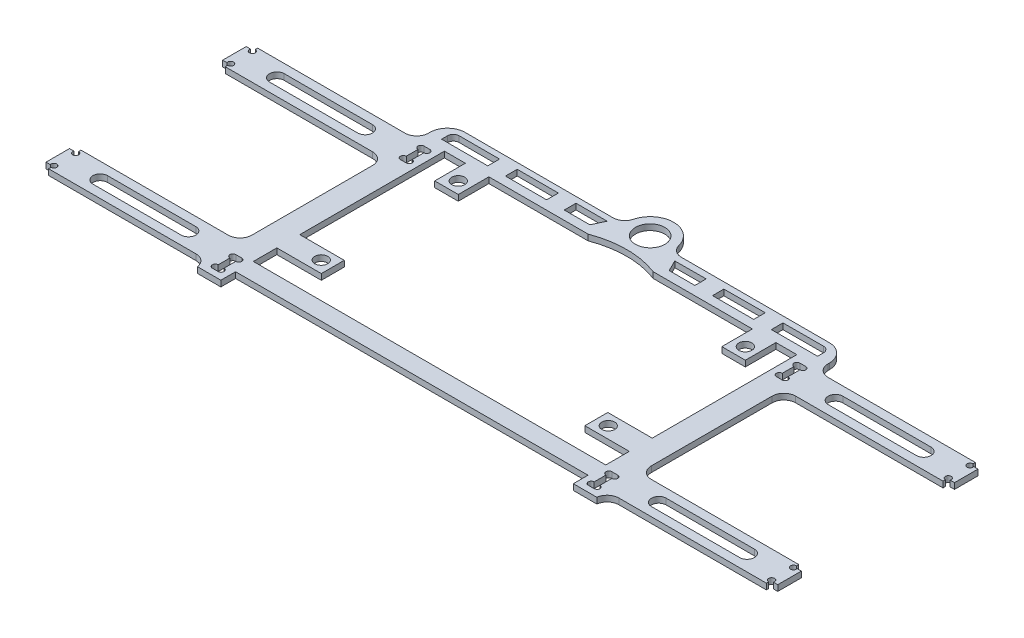
from build123d import *

# Parameters (mm, degrees)
SKETCH_1_R          = 2.5
SKETCH_1_R_2        = 1.1
EXTRUDE_1_DEPTH     = 1
FILLET_1_R          = 3
FILLET_2_R          = 2
CUT_EXTRUDE_2_DEPTH = 10
FILLET_3_R          = 2
FILLET_4_R          = 1


with BuildPart() as part:
    # 草图1 → 凸台-拉伸1 (new body)
    with BuildSketch(Plane(origin=(0, 0, 0), x_dir=(1, 0, 0), z_dir=(0, 1, 0))):
        with BuildLine():
            Line((52.019723734, 21.852163266), (53.019723735, 21.852163266))
            Line((53.019723735, 21.852163266), (53.019757158, 21.448163261))
            ThreePointArc((53.019757158, 21.448163261), (52.725753796, 20.543789849), (53.495525432, 21.102163266))
            Line((53.495525432, 21.102163266), (53.519723734, 21.102163266))
            Line((53.519723734, 21.102163266), (54.019723733, 21.102163266))
            Line((54.019723733, 21.102163266), (54.219723734, 21.102163266))
            Line((54.219723734, 21.102163266), (54.219723734, 17.102163266))
            Line((54.219723734, 17.102163266), (54.019723733, 17.102163266))
            Line((54.019723733, 17.102163266), (53.519723734, 17.102163266))
            Line((53.519723734, 17.102163266), (53.496801854, 17.102163266))
            ThreePointArc((53.496801854, 17.102163266), (52.724058887, 17.655298623), (53.01975629, 16.752163272))
            Line((53.01975629, 16.752163272), (53.019723735, 16.352163266))
            Line((53.019723735, 16.352163266), (52.019723734, 16.352163266))
            Line((52.019723734, 16.352163266), (25.97614752, 16.352163266))
            Line((25.97614752, 16.352163266), (25.97614752, -8.184190297))
            Line((25.97614752, -8.184190297), (51.519723734, -8.184190297))
            Line((51.519723734, -8.184190297), (52.019723734, -8.184190297))
            Line((52.019723734, -8.184190297), (53.019723735, -8.184190297))
            Line((53.019723735, -8.184190297), (53.019748777, -8.580190295))
            ThreePointArc((53.019748777, -8.580190295), (52.724061912, -9.483327864), (53.496801857, -8.930190297))
            Line((53.496801857, -8.930190297), (53.519723734, -8.930190297))
            Line((53.519723734, -8.930190297), (54.019723734, -8.930190297))
            Line((54.019723734, -8.930190297), (54.219723734, -8.930190297))
            Line((54.219723734, -8.930190297), (54.219723734, -12.930190297))
            Line((54.219723734, -12.930190297), (54.019723734, -12.930190297))
            Line((54.019723734, -12.930190297), (53.519723734, -12.930190297))
            Line((53.519723734, -12.930190297), (53.496801854, -12.930190297))
            ThreePointArc((53.496801854, -12.930190297), (52.724072011, -12.377045312), (53.019723734, -13.280190285))
            Line((53.019723734, -13.280190285), (53.019723734, -13.680190297))
            Line((53.019723734, -13.680190297), (52.019723734, -13.680190297))
            Line((52.019723734, -13.680190297), (25.97614752, -13.680190297))
            Line((25.97614752, -13.680190297), (25.97614752, -13.930190297))
            Line((25.97614752, -13.930190297), (25.97614752, -15.447203953))
            Line((25.97614752, -15.447203953), (21.97614752, -15.447203953))
            Line((21.97614752, -15.447203953), (21.97614752, -12.947203953))
            Line((21.97614752, -12.947203953), (-37.940585629, -12.947203953))
            Line((-37.940585629, -12.947203953), (-37.940585629, -15.447203953))
            Line((-37.940585629, -15.447203953), (-41.940585629, -15.447203953))
            Line((-41.940585629, -15.447203953), (-41.940585629, -13.930190297))
            Line((-41.940585629, -13.930190297), (-41.940585629, -13.680190297))
            Line((-41.940585629, -13.680190297), (-67.984161843, -13.680190297))
            Line((-67.984161843, -13.680190297), (-68.984161843, -13.680190297))
            Line((-68.984161843, -13.680190297), (-68.984161843, -13.280190297))
            ThreePointArc((-68.984161843, -13.280190297), (-68.688357854, -12.37707741), (-69.461131444, -12.930190297))
            Line((-69.461131444, -12.930190297), (-69.484161843, -12.930190297))
            Line((-69.484161843, -12.930190297), (-69.984161843, -12.930190297))
            Line((-69.984161843, -12.930190297), (-70.184161843, -12.930190297))
            Line((-70.184161843, -12.930190297), (-70.184161843, -8.930190297))
            Line((-70.184161843, -8.930190297), (-69.984161843, -8.930190297))
            Line((-69.984161843, -8.930190297), (-69.484161843, -8.930190297))
            Line((-69.484161843, -8.930190297), (-69.461131444, -8.930190297))
            ThreePointArc((-69.461131444, -8.930190297), (-68.688357854, -9.483303184), (-68.984161844, -8.580190297))
            Line((-68.984161844, -8.580190297), (-68.984161844, -8.184190297))
            Line((-68.984161844, -8.184190297), (-67.984161843, -8.184190297))
            Line((-67.984161843, -8.184190297), (-67.484161843, -8.184190297))
            Line((-67.484161843, -8.184190297), (-41.940585629, -8.184190297))
            Line((-41.940585629, -8.184190297), (-41.940585629, 16.352163266))
            Line((-41.940585629, 16.352163266), (-67.984161843, 16.352163266))
            Line((-67.984161843, 16.352163266), (-68.984161844, 16.352163266))
            Line((-68.984161844, 16.352163266), (-68.984161844, 16.756163266))
            ThreePointArc((-68.984161844, 16.756163266), (-68.689970599, 17.660454636), (-69.459917768, 17.102357219))
            Line((-69.459917768, 17.102357219), (-69.484161843, 17.102163266))
            Line((-69.484161843, 17.102163266), (-69.984161842, 17.102163266))
            Line((-69.984161842, 17.102163266), (-70.184161842, 17.102163266))
            Line((-70.184161842, 17.102163266), (-70.184161842, 21.102163266))
            Line((-70.184161842, 21.102163266), (-69.984161842, 21.102163266))
            Line((-69.984161842, 21.102163266), (-69.484161843, 21.102163266))
            Line((-69.484161843, 21.102163266), (-69.461131444, 21.102163266))
            ThreePointArc((-69.461131444, 21.102163266), (-68.688357854, 20.549050379), (-68.984161844, 21.452163266))
            Line((-68.984161844, 21.452163266), (-68.984161844, 21.852163266))
            Line((-68.984161844, 21.852163266), (-67.984161843, 21.852163266))
            Line((-67.984161843, 21.852163266), (-41.940585629, 21.852163266))
            Line((-41.940585629, 21.852163266), (-41.940585629, 22.106163266))
            Line((-41.940585629, 22.106163266), (-41.940585629, 23.122837731))
            Line((-41.940585629, 23.122837731), (-41.940585629, 27.072840592))
            Line((-41.940585629, 27.072840592), (-11.950846021, 27.072840592))
            ThreePointArc((-11.950846021, 27.072840592), (-7.982219055, 31.572840592), (-4.013592088, 27.072840592))
            Line((-4.013592088, 27.072840592), (25.97614752, 27.072840592))
            Line((25.97614752, 27.072840592), (25.97614752, 23.122837731))
            Line((25.97614752, 23.122837731), (25.97614752, 22.106163266))
            Line((25.97614752, 22.106163266), (25.97614752, 21.852163266))
            Line((25.97614752, 21.852163266), (52.019723734, 21.852163266))
        make_face()
        with Locations(Location((-7.982219055, 27.572840592, 0), (0, 0, 270))):
            Circle(SKETCH_1_R, mode=Mode.SUBTRACT)
        with Locations(Location((-32.382219055, 19.352796047, 0), (0, 0, 270))):
            Circle(SKETCH_1_R_2, mode=Mode.SUBTRACT)
        with Locations(Location((16.417780945, 19.352796047, 0), (0, 0, 270))):
            Circle(SKETCH_1_R_2, mode=Mode.SUBTRACT)
        with Locations(Location((-32.382219055, -3.947203953, 0), (0, 0, 270))):
            Circle(SKETCH_1_R_2, mode=Mode.SUBTRACT)
        with Locations(Location((16.417780945, -3.947203953, 0), (0, 0, 270))):
            Circle(SKETCH_1_R_2, mode=Mode.SUBTRACT)
        with BuildLine():
            Line((-37.940585629, 20.052796047), (-37.940585629, 17.052796047))
            Line((-37.940585629, 17.052796047), (-37.940585629, 16.552796047))
            Line((-37.940585629, 16.552796047), (-37.940585629, -2.030190297))
            Line((-37.940585629, -2.030190297), (-30.582219055, -2.030190297))
            Line((-30.582219055, -2.030190297), (-30.382219055, -2.030190297))
            Line((-30.382219055, -2.030190297), (-30.382219055, -5.930190297))
            Line((-30.382219055, -5.930190297), (-37.940585629, -5.930190297))
            Line((-37.940585629, -5.930190297), (-37.940585629, -6.730190297))
            Line((-37.940585629, -6.730190297), (-37.940585629, -8.930190297))
            Line((-37.940585629, -8.930190297), (-37.940585629, -9.930190297))
            Line((-37.940585629, -9.930190297), (21.97614752, -9.930190297))
            Line((21.97614752, -9.930190297), (21.97614752, -8.930190297))
            Line((21.97614752, -8.930190297), (21.97614752, -6.730190297))
            Line((21.97614752, -6.730190297), (21.97614752, -5.930190297))
            Line((21.97614752, -5.930190297), (14.417780946, -5.930190297))
            Line((14.417780946, -5.930190297), (14.417780946, -2.030190297))
            Line((14.417780946, -2.030190297), (21.97614752, -2.030190297))
            Line((21.97614752, -2.030190297), (21.97614752, 16.552796047))
            Line((21.97614752, 16.552796047), (21.97614752, 20.552796047))
            Line((21.97614752, 20.552796047), (21.97614752, 21.552796047))
            Line((21.97614752, 21.552796047), (21.97614752, 22.552796047))
            Line((21.97614752, 22.552796047), (18.417780946, 22.552796047))
            Line((18.417780946, 22.552796047), (18.417780946, 17.352796047))
            Line((18.417780946, 17.352796047), (14.417780946, 17.352796047))
            Line((14.417780946, 17.352796047), (14.417780946, 22.552796047))
            Line((14.417780946, 22.552796047), (-1.176889757, 22.552796047))
            Line((-1.176889757, 22.552796047), (-2.453882338, 22.552796047))
            ThreePointArc((-2.453882338, 22.552796047), (-7.982219055, 23.572205826), (-13.510555771, 22.552796047))
            Line((-13.510555771, 22.552796047), (-14.787548352, 22.552796047))
            Line((-14.787548352, 22.552796047), (-30.382219055, 22.552796047))
            Line((-30.382219055, 22.552796047), (-30.382219055, 17.352796047))
            Line((-30.382219055, 17.352796047), (-34.382219055, 17.352796047))
            Line((-34.382219055, 17.352796047), (-34.382219055, 22.552796047))
            Line((-34.382219055, 22.552796047), (-37.940585629, 22.552796047))
            Line((-37.940585629, 22.552796047), (-37.940585629, 21.552796047))
            Line((-37.940585629, 21.552796047), (-37.940585629, 20.552796047))
            Line((-37.940585629, 20.552796047), (-37.940585629, 20.052796047))
        make_face(mode=Mode.SUBTRACT)
        with BuildLine():
            Line((-40.440585629, 21.569809703), (-39.440585629, 21.569809703))
            ThreePointArc((-39.440585629, 21.569809703), (-38.940585629, 21.069809703), (-39.440585629, 20.569809703))
            Line((-39.440585629, 20.569809703), (-39.440585629, 18.569809703))
            ThreePointArc((-39.440585629, 18.569809703), (-38.940585629, 18.069809703), (-39.440585629, 17.569809703))
            Line((-39.440585629, 17.569809703), (-40.440585629, 17.569809703))
            ThreePointArc((-40.440585629, 17.569809703), (-40.940585629, 18.069809703), (-40.440585629, 18.569809703))
            Line((-40.440585629, 18.569809703), (-40.440585629, 20.569809703))
            ThreePointArc((-40.440585629, 20.569809703), (-40.940585629, 21.069809703), (-40.440585629, 21.569809703))
        make_face(mode=Mode.SUBTRACT)
        with BuildLine():
            Line((23.47614752, 21.569809703), (24.47614752, 21.569809703))
            ThreePointArc((24.47614752, 21.569809703), (24.97614752, 21.069809703), (24.47614752, 20.569809703))
            Line((24.47614752, 20.569809703), (24.47614752, 18.569809703))
            ThreePointArc((24.47614752, 18.569809703), (24.97614752, 18.069809703), (24.47614752, 17.569809703))
            Line((24.47614752, 17.569809703), (23.47614752, 17.569809703))
            ThreePointArc((23.47614752, 17.569809703), (22.97614752, 18.069809703), (23.47614752, 18.569809703))
            Line((23.47614752, 18.569809703), (23.47614752, 20.569809703))
            ThreePointArc((23.47614752, 20.569809703), (22.97614752, 21.069809703), (23.47614752, 21.569809703))
        make_face(mode=Mode.SUBTRACT)
        with BuildLine():
            Line((23.47614752, -10.405665948), (24.47614752, -10.405665948))
            ThreePointArc((24.47614752, -10.405665948), (24.97614752, -10.905665948), (24.47614752, -11.405665948))
            Line((24.47614752, -11.405665948), (24.47614752, -13.405665948))
            ThreePointArc((24.47614752, -13.405665948), (24.97614752, -13.905665948), (24.47614752, -14.405665948))
            Line((24.47614752, -14.405665948), (23.47614752, -14.405665948))
            ThreePointArc((23.47614752, -14.405665948), (22.97614752, -13.905665948), (23.47614752, -13.405665948))
            Line((23.47614752, -13.405665948), (23.47614752, -11.405665948))
            ThreePointArc((23.47614752, -11.405665948), (22.97614752, -10.905665948), (23.47614752, -10.405665948))
        make_face(mode=Mode.SUBTRACT)
        with BuildLine():
            Line((-40.440585629, -10.405665948), (-39.440585629, -10.405665948))
            ThreePointArc((-39.440585629, -10.405665948), (-38.940585629, -10.905665948), (-39.440585629, -11.405665948))
            Line((-39.440585629, -11.405665948), (-39.440585629, -13.405665948))
            ThreePointArc((-39.440585629, -13.405665948), (-38.940585629, -13.905665948), (-39.440585629, -14.405665948))
            Line((-39.440585629, -14.405665948), (-40.440585629, -14.405665948))
            ThreePointArc((-40.440585629, -14.405665948), (-40.940585629, -13.905665948), (-40.440585629, -13.405665948))
            Line((-40.440585629, -13.405665948), (-40.440585629, -11.405665948))
            ThreePointArc((-40.440585629, -11.405665948), (-40.940585629, -10.905665948), (-40.440585629, -10.405665948))
        make_face(mode=Mode.SUBTRACT)
    extrude(amount=EXTRUDE_1_DEPTH)

    # 圆角1
    fillet_1_edges = [part.edges().sort_by_distance(p)[0] for p in [
        (-41.940585629, 0.5, -27.072840592),
        (25.97614752, 0.5, -27.072840592),
    ]]
    fillet(fillet_1_edges, radius=FILLET_1_R)

    # 圆角2
    # the kernel refuses this fillet: 2 mm, written as the material it adds along each edge
    with BuildSketch(Plane(origin=(-41.940585629, 0, -21.852163266), x_dir=(0, 0, -1), z_dir=(0, 1, 0)), Plane(origin=(-41.940585629, 0, 8.184190297), x_dir=(0, 0, -1), z_dir=(0, 1, 0)), Plane(origin=(-41.940585629, 0, -16.352163266), x_dir=(-1, 0, 0), z_dir=(0, 1, 0))) as fillet_2_piece_1:
        with BuildLine():
            CenterArc((FILLET_2_R, FILLET_2_R), FILLET_2_R, 180, 90)
            Line((0, FILLET_2_R), (-FILLET_2_R * 0.02, FILLET_2_R))
            Line((-FILLET_2_R * 0.02, FILLET_2_R), (-FILLET_2_R * 0.02, -FILLET_2_R * 0.02))
            Line((-FILLET_2_R * 0.02, -FILLET_2_R * 0.02), (FILLET_2_R, -FILLET_2_R * 0.02))
            Line((FILLET_2_R, -FILLET_2_R * 0.02), (FILLET_2_R, 0))
        make_face()
    extrude(amount=1)
    with BuildSketch(Plane(origin=(25.97614752, 0, -21.852163266), x_dir=(0, 0, -1), z_dir=(0, 1, 0)), Plane(origin=(25.97614752, 0, -16.352163266), x_dir=(1, 0, 0), z_dir=(0, 1, 0)), Plane(origin=(25.97614752, 0, 8.184190297), x_dir=(0, 0, -1), z_dir=(0, 1, 0))) as fillet_2_piece_2:
        with BuildLine():
            CenterArc((FILLET_2_R, -FILLET_2_R), FILLET_2_R, 90, 90)
            Line((0, -FILLET_2_R), (-FILLET_2_R * 0.02, -FILLET_2_R))
            Line((-FILLET_2_R * 0.02, -FILLET_2_R), (-FILLET_2_R * 0.02, FILLET_2_R * 0.02))
            Line((-FILLET_2_R * 0.02, FILLET_2_R * 0.02), (FILLET_2_R, FILLET_2_R * 0.02))
            Line((FILLET_2_R, FILLET_2_R * 0.02), (FILLET_2_R, 0))
        make_face()
    extrude(amount=1)
    with BuildSketch(Plane(origin=(25.97614752, 0, 13.680190297), x_dir=(1, 0, 0), z_dir=(0, 1, 0))) as fillet_2_piece_3:
        with BuildLine():
            CenterArc((1.986382985, -2), FILLET_2_R, 90, 83.310243577)
            Line((0, -1.767013656), (-0.03972766, -1.762353929))
            ThreePointArc((-0.03972766, -1.762353929), (-0.04, -0.883506828), (-0.04, 0))
            Line((-0.04, 0), (0, 0.04))
            Line((0, 0.04), (1.986382985, 0.04))
            Line((1.986382985, 0.04), (1.986382985, 0))
        make_face()
    extrude(amount=1)
    with BuildSketch(Plane(origin=(-41.940585629, 0, 13.680190297), x_dir=(-1, 0, 0), z_dir=(0, 1, 0))) as fillet_2_piece_4:
        with BuildLine():
            CenterArc((1.986382985, 2), FILLET_2_R, 186.689756423, 83.310243577)
            Line((0, 1.767013656), (-0.03972766, 1.762353929))
            ThreePointArc((-0.03972766, 1.762353929), (-0.04, 0.883506828), (-0.04, 0))
            Line((-0.04, 0), (0, -0.04))
            Line((0, -0.04), (1.986382985, -0.04))
            Line((1.986382985, -0.04), (1.986382985, 0))
        make_face()
    extrude(amount=1)

    # 草图7 → 切除-拉伸2 (cut)
    with BuildSketch(Plane(origin=(0, 1, 0), x_dir=(1, 0, 0), z_dir=(0, 1, 0))):
        with BuildLine():
            Line((-47.962373737, 20.348163266), (-62.962373736, 20.348163266))
            ThreePointArc((-62.962373736, 20.348163266), (-64.208373736, 19.102163266), (-62.962373736, 17.856163266))
            Line((-62.962373736, 17.856163266), (-47.962373737, 17.856163266))
            ThreePointArc((-47.962373737, 17.856163266), (-46.716373737, 19.102163266), (-47.962373737, 20.348163266))
        make_face()
        with BuildLine():
            Line((-47.962373737, -9.684190297), (-62.962373736, -9.684190297))
            ThreePointArc((-62.962373736, -9.684190297), (-64.210373736, -10.932190297), (-62.962373736, -12.180190297))
            Line((-62.962373736, -12.180190297), (-47.962373737, -12.180190297))
            ThreePointArc((-47.962373737, -12.180190297), (-46.714373737, -10.932190297), (-47.962373737, -9.684190297))
        make_face()
        Polygon((-32.0852524, 26.072840592), (-32.0852524, 24.072840592), (-37.440585629, 24.072840592), (-39.940585629, 24.072840592), (-39.940585629, 26.072840592), align=None)
        Polygon((-29.0852524, 26.072840592), (-22.0852524, 26.072840592), (-22.0852524, 24.072840592), (-26.0852524, 24.072840592), (-29.0852524, 24.072840592), align=None)
        Polygon((-19.0852524, 26.072840592), (-19.0852524, 24.072840592), (-14.72991917, 24.072840592), (-13.791694074, 26.072840592), align=None)
        Polygon((3.12081429, 25.99409626), (-2.19916287, 25.974009406), (-1.249674429, 24.072840592), (3.12081429, 24.072840592), align=None)
        Polygon((6.12081429, 26.005423482), (6.12081429, 24.072840592), (13.12081429, 24.072840592), (13.12081429, 26.031853668), align=None)
        Polygon((21.476147519, 24.072840592), (23.976147519, 24.072840592), (23.976147519, 26.072840592), (16.12081429, 26.04318089), (16.12081429, 24.072840592), align=None)
        with BuildLine():
            ThreePointArc((46.997935627, 20.348163266), (48.243935627, 19.102163266), (46.997935627, 17.856163266))
            Line((46.997935627, 17.856163266), (31.997935628, 17.856163266))
            ThreePointArc((31.997935628, 17.856163266), (30.751935628, 19.102163266), (31.997935628, 20.348163266))
            Line((31.997935628, 20.348163266), (46.997935627, 20.348163266))
        make_face()
        with BuildLine():
            ThreePointArc((46.997935627, -9.684190297), (48.245935627, -10.932190297), (46.997935627, -12.180190297))
            Line((46.997935627, -12.180190297), (31.997935628, -12.180190297))
            ThreePointArc((31.997935628, -12.180190297), (30.749935628, -10.932190297), (31.997935628, -9.684190297))
            Line((31.997935628, -9.684190297), (46.997935627, -9.684190297))
        make_face()
    extrude(amount=-CUT_EXTRUDE_2_DEPTH, mode=Mode.SUBTRACT)

    # 圆角3
    fillet_3_edges = [part.edges().sort_by_distance(p)[0] for p in [
        (-11.950846021, 0.5, -27.072840592),
        (-4.013592088, 0.5, -27.072840592),
    ]]
    fillet(fillet_3_edges, radius=FILLET_3_R)

    # 圆角4
    fillet_4_edges = [part.edges().sort_by_distance(p)[0] for p in [
        (-39.940585629, 0.5, -26.072840592),
        (23.976147519, 0.5, -26.072840592),
    ]]
    fillet(fillet_4_edges, radius=FILLET_4_R)


solid = part.part
